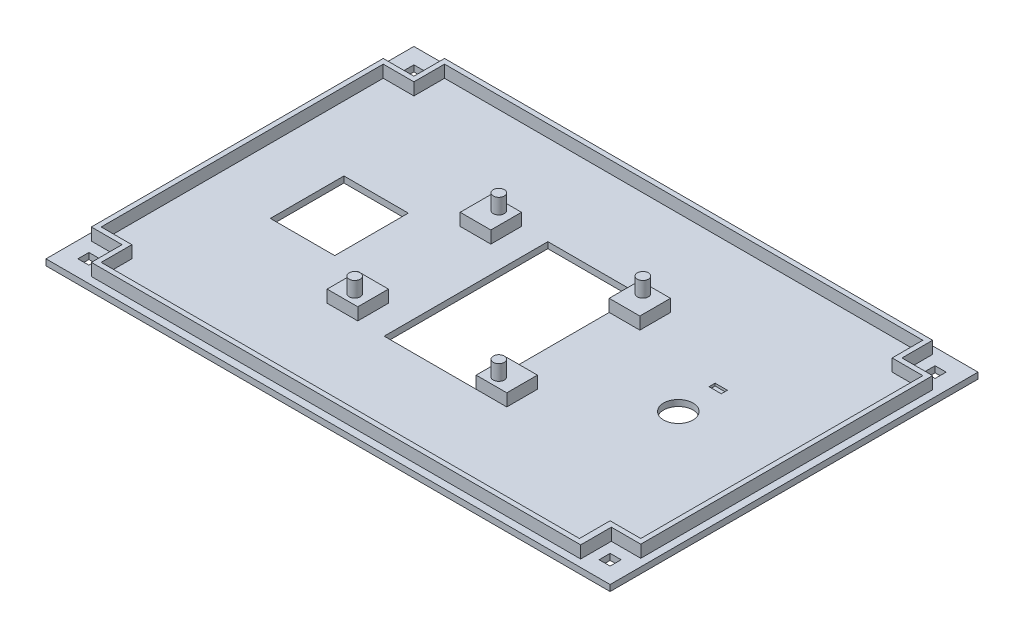
from build123d import *

# Parameters (mm, degrees)
SKETCH_1_W           = 92
SKETCH_1_H           = 60
EXTRUDE_1_DEPTH      = 1
EXTRUDE_3_DEPTH      = 2
SKETCH_6_W           = 1.8
SKETCH_6_H           = 1.8
CUT_EXTRUDE_3_DEPTH  = 1
SKETCH_7_W           = 1.8
SKETCH_7_H           = 1.8
CUT_EXTRUDE_4_DEPTH  = 1
SKETCH_8_W           = 1.8
SKETCH_8_H           = 1.8
CUT_EXTRUDE_5_DEPTH  = 1
SKETCH_9_W           = 1.8
SKETCH_9_H           = 1.8
CUT_EXTRUDE_6_DEPTH  = 1
SKETCH_15_W          = 15
SKETCH_15_H          = 26.7
CUT_EXTRUDE_8_DEPTH  = 1
SKETCH_18_W          = 5
SKETCH_18_H          = 5
EXTRUDE_4_DEPTH      = 2
SKETCH_19_R          = 0.9
EXTRUDE_5_DEPTH      = 2.5
SKETCH_10_W          = 10.5
SKETCH_10_H          = 12
CUT_EXTRUDE_9_DEPTH  = 1
SKETCH_20_R          = 2.4
CUT_EXTRUDE_11_DEPTH = 1
SKETCH_21_W          = 2
SKETCH_21_H          = 1
CUT_EXTRUDE_12_DEPTH = 0.4
CUT_EXTRUDE_13_DEPTH = 0.4


with BuildPart() as part:
    # Эскиз1 → Бобышка-Вытянуть1 (new body)
    with BuildSketch(Plane(origin=(0, 0, 0), x_dir=(1, 0, 0), z_dir=(0, 1, 0))):
        with Locations((46, 30)):
            Rectangle(SKETCH_1_W, SKETCH_1_H)
    extrude(amount=EXTRUDE_1_DEPTH)

    # Эскиз3 → Бобышка-Вытянуть3 (add)
    with BuildSketch(Plane(origin=(0, 1, 0), x_dir=(1, 0, 0), z_dir=(0, 1, 0))):
        Polygon((85.8, 53.8), (90.8, 53.8), (90.8, 6.2), (86, 6.2), (86, 1.2), (6.2, 1.2), (6.2, 6.2), (1.2, 6.2), (1.2, 53.8), (6.2, 53.8), (6.2, 58.8), (85.8, 58.8), align=None)
        Polygon((7, 58), (7, 53), (2, 53), (2, 7), (7, 7), (7, 2), (85, 2), (85, 7), (90, 7), (90, 53), (85, 53), (85, 58), align=None, mode=Mode.SUBTRACT)
    extrude(amount=EXTRUDE_3_DEPTH)

    # Эскиз6 → Вырез-Вытянуть3 (cut)
    with BuildSketch(Plane(origin=(0, 1, 0), x_dir=(1, 0, 0), z_dir=(0, 1, 0))):
        with Locations((3.5, 56.5)):
            Rectangle(SKETCH_6_W, SKETCH_6_H)
    extrude(amount=-CUT_EXTRUDE_3_DEPTH, mode=Mode.SUBTRACT)

    # Эскиз7 → Вырез-Вытянуть4 (cut)
    with BuildSketch(Plane(origin=(0, 1, 0), x_dir=(1, 0, 0), z_dir=(0, 1, 0))):
        with Locations((88.5, 56.5)):
            Rectangle(SKETCH_7_W, SKETCH_7_H)
    extrude(amount=-CUT_EXTRUDE_4_DEPTH, mode=Mode.SUBTRACT)

    # Эскиз8 → Вырез-Вытянуть5 (cut)
    with BuildSketch(Plane(origin=(0, 1, 0), x_dir=(1, 0, 0), z_dir=(0, 1, 0))):
        with Locations((88.5, 3.5)):
            Rectangle(SKETCH_8_W, SKETCH_8_H)
    extrude(amount=-CUT_EXTRUDE_5_DEPTH, mode=Mode.SUBTRACT)

    # Эскиз9 → Вырез-Вытянуть6 (cut)
    with BuildSketch(Plane(origin=(0, 1, 0), x_dir=(1, 0, 0), z_dir=(0, 1, 0))):
        with Locations((3.5, 3.5)):
            Rectangle(SKETCH_9_W, SKETCH_9_H)
    extrude(amount=-CUT_EXTRUDE_6_DEPTH, mode=Mode.SUBTRACT)

    # Эскиз15 → Вырез-Вытянуть8 (cut)
    with BuildSketch(Plane(origin=(0, 1, 0), x_dir=(1, 0, 0), z_dir=(0, 1, 0))):
        with Locations((46, 30)):
            Rectangle(SKETCH_15_W, SKETCH_15_H)
    extrude(amount=-CUT_EXTRUDE_8_DEPTH, mode=Mode.SUBTRACT)

    # Эскиз18 → Бобышка-Вытянуть4 (add)
    with BuildSketch(Plane(origin=(0, 1, 0), x_dir=(1, 0, 0), z_dir=(0, 1, 0))):
        with Locations((31.7, 40.85)):
            Rectangle(SKETCH_18_W, SKETCH_18_H)
        with Locations((31.7, 19.15)):
            Rectangle(SKETCH_18_W, SKETCH_18_H)
        with Locations((56, 40.85)):
            Rectangle(SKETCH_18_W, SKETCH_18_H)
        with Locations((56, 19.15)):
            Rectangle(SKETCH_18_W, SKETCH_18_H)
    extrude(amount=EXTRUDE_4_DEPTH)

    # Эскиз19 → Бобышка-Вытянуть5 (add)
    with BuildSketch(Plane(origin=(0, 3, 0), x_dir=(1, 0, 0), z_dir=(0, 1, 0))):
        with Locations((32.1, 41.75)):
            Circle(SKETCH_19_R)
        with Locations((32.1, 18.25)):
            Circle(SKETCH_19_R)
        with Locations((55.6, 41.75)):
            Circle(SKETCH_19_R)
        with Locations((55.6, 18.25)):
            Circle(SKETCH_19_R)
    extrude(amount=EXTRUDE_5_DEPTH)

    # Эскиз10 → Вырез-Вытянуть9 (cut)
    with BuildSketch(Plane(origin=(0, 1, 0), x_dir=(1, 0, 0), z_dir=(0, 1, 0))):
        with Locations((17.837788163, 30)):
            Rectangle(SKETCH_10_W, SKETCH_10_H)
    extrude(amount=-CUT_EXTRUDE_9_DEPTH, mode=Mode.SUBTRACT)

    # Эскиз20 → Вырез-Вытянуть11 (cut)
    with BuildSketch(Plane(origin=(0, 1, 0), x_dir=(1, 0, 0), z_dir=(0, 1, 0))):
        with Locations((73.124146683, 30)):
            Circle(SKETCH_20_R)
    extrude(amount=-CUT_EXTRUDE_11_DEPTH, mode=Mode.SUBTRACT)

    # Эскиз21 → Вырез-Вытянуть12 (cut)
    with BuildSketch(Plane(origin=(0, 1, 0), x_dir=(1, 0, 0), z_dir=(0, 1, 0))):
        with Locations((73.124146683, 36.5)):
            Rectangle(SKETCH_21_W, SKETCH_21_H)
    extrude(amount=-CUT_EXTRUDE_12_DEPTH, mode=Mode.SUBTRACT)

    # Эскиз22 → Вырез-Вытянуть13 (cut)
    # profile 1 of 19: a face of its own
    with BuildSketch(Plane(origin=(0, 0, 0), x_dir=(-1, 0, 0), z_dir=(0, -1, 0))):
        with BuildLine():
            Line((-6.570655821, 25.424472737), (-6.469404796, 25.859111284))
            add(Edge.make_bspline(
                [(-6.469404796, 25.859111284), (-6.42866707, 25.848222688), (-6.348979021, 25.826923244), (-6.234941019, 25.784806046), (-6.127904498, 25.737555442), (-6.028228713, 25.683932135), (-5.936347059, 25.62376797), (-5.851798196, 25.557325766), (-5.774447685, 25.484615344), (-5.705249825, 25.405078748), (-5.64335716, 25.320786828), (-5.590308991, 25.231149588), (-5.544050852, 25.13775734), (-5.506972443, 25.039082562), (-5.478848705, 24.935849752), (-5.458415772, 24.828316195), (-5.44581431, 24.716220632), (-5.444156624, 24.639810452), (-5.44331209, 24.600882082)],
                knots=[0, 0, 0, 0, 1.145367768, 2.240481511, 3.299486216, 4.322926322, 5.312543435, 6.280301985, 7.2416403, 8.192823262, 9.141388579, 10.079393599, 11.019812878, 11.970222822, 12.938950422, 13.923894909, 14.942295558, 16, 16, 16, 16], degree=3))
            add(Edge.make_bspline(
                [(-5.44331209, 24.600882082), (-5.443899781, 24.560942698), (-5.445049549, 24.482804485), (-5.454179645, 24.368307837), (-5.470558105, 24.259560116), (-5.491508604, 24.156173744), (-5.520271057, 24.058881927), (-5.554583179, 23.966980521), (-5.596126954, 23.881262605), (-5.64325851, 23.800821066), (-5.696831647, 23.726033128), (-5.755366986, 23.655188809), (-5.820484911, 23.590010412), (-5.890645542, 23.52886757), (-5.966775043, 23.473092173), (-6.047838988, 23.420632185), (-6.135265768, 23.37404816), (-6.227434476, 23.331613726), (-6.323452756, 23.294368116), (-6.421423981, 23.261418779), (-6.52154337, 23.234480895), (-6.622968435, 23.211289115), (-6.726552598, 23.194441411), (-6.831518662, 23.181064855), (-6.938510159, 23.173710156), (-7.010429062, 23.172742355), (-7.046659116, 23.172254813)],
                knots=[0, 0, 0, 0, 1.180680974, 2.309907975, 3.39230657, 4.430402719, 5.425739985, 6.38846843, 7.327253855, 8.238163682, 9.141319901, 10.044148192, 10.951882972, 11.861898394, 12.79276478, 13.739539846, 14.714057202, 15.718574761, 16.737652364, 17.7573291, 18.772768038, 19.801551793, 20.831755737, 21.873891013, 22.928945814, 24, 24, 24, 24], degree=3))
            add(Edge.make_bspline(
                [(-7.046659116, 23.172254813), (-7.085770876, 23.172952237), (-7.163045836, 23.17433017), (-7.277068033, 23.182105104), (-7.387110534, 23.196395531), (-7.493258994, 23.21620551), (-7.595742304, 23.241444119), (-7.694584556, 23.272170252), (-7.789383645, 23.308824995), (-7.880165198, 23.350454956), (-7.965820446, 23.3983352), (-8.047112416, 23.449875639), (-8.12245872, 23.50713182), (-8.193247002, 23.568128034), (-8.258272467, 23.634435586), (-8.317689317, 23.705839429), (-8.372037669, 23.781726863), (-8.420813468, 23.862085913), (-8.463611654, 23.945866435), (-8.501732378, 24.031823953), (-8.532977491, 24.120300374), (-8.558956548, 24.210594228), (-8.57963829, 24.30289991), (-8.593468235, 24.397433102), (-8.602480899, 24.494106454), (-8.603702331, 24.559291178), (-8.604319703, 24.592238701)],
                knots=[0, 0, 0, 0, 1.185610122, 2.34246615, 3.46204209, 4.547238403, 5.613845268, 6.659506797, 7.682407252, 8.692734231, 9.683951048, 10.654680354, 11.607833779, 12.549673105, 13.484816388, 14.419272854, 15.362680812, 16.31159957, 17.265732262, 18.21261905, 19.159670199, 20.10733745, 21.059306249, 22.024427552, 23.00144979, 24, 24, 24, 24], degree=3))
            add(Edge.make_bspline(
                [(-8.604319703, 24.592238701), (-8.603652237, 24.629108303), (-8.602340266, 24.701579156), (-8.590721426, 24.807782632), (-8.573311226, 24.909922408), (-8.547027641, 25.007202849), (-8.514784453, 25.100540365), (-8.473198343, 25.188464658), (-8.426078288, 25.272764465), (-8.37074248, 25.351878016), (-8.30900408, 25.426041853), (-8.241014787, 25.494587517), (-8.167224578, 25.557389804), (-8.087056239, 25.61367133), (-8.001050806, 25.664204492), (-7.909376708, 25.709532327), (-7.811449519, 25.748574864), (-7.743231079, 25.769454459), (-7.708495084, 25.780086093)],
                knots=[0, 0, 0, 0, 1.098215313, 2.158650937, 3.179873416, 4.182349117, 5.157851008, 6.118027029, 7.076341197, 8.032298369, 8.990121974, 9.948357669, 10.905435138, 11.873450097, 12.863034414, 13.874936208, 14.917943528, 16, 16, 16, 16], degree=3))
            Line((-7.708495084, 25.780086093), (-7.615270055, 25.345447547))
            add(Edge.make_bspline(
                [(-7.615270055, 25.345447547), (-7.641927536, 25.336911924), (-7.694104473, 25.320205069), (-7.768465881, 25.290540415), (-7.837497564, 25.258503577), (-7.900730274, 25.223331412), (-7.958179157, 25.184947695), (-8.010542419, 25.1442363), (-8.056842693, 25.100221824), (-8.098147547, 25.053799556), (-8.13333533, 25.00377074), (-8.164517496, 24.951308266), (-8.190315984, 24.895305965), (-8.212136175, 24.83656947), (-8.228743691, 24.774549778), (-8.240427734, 24.709499442), (-8.247189886, 24.641361307), (-8.248194152, 24.594928994), (-8.248706346, 24.571247635)],
                knots=[0, 0, 0, 0, 1.235697765, 2.418642872, 3.532555292, 4.594392283, 5.610119701, 6.580908344, 7.519430642, 8.427315627, 9.319973334, 10.216139639, 11.118687699, 12.038725643, 12.980015607, 13.949697744, 14.954307006, 16, 16, 16, 16], degree=3))
            add(Edge.make_bspline(
                [(-8.248706346, 24.571247635), (-8.248311504, 24.54405943), (-8.247534966, 24.490588254), (-8.239048929, 24.412029901), (-8.226523283, 24.336597086), (-8.207835559, 24.264803466), (-8.184238667, 24.196509333), (-8.156046818, 24.131405139), (-8.121735943, 24.069921589), (-8.082406539, 24.012121135), (-8.038255026, 23.958332122), (-7.990821012, 23.908365172), (-7.939993445, 23.862346005), (-7.885470108, 23.820826752), (-7.827051837, 23.783799683), (-7.765294928, 23.750291573), (-7.699786217, 23.721359095), (-7.607900086, 23.688657143), (-7.489324729, 23.656503936), (-7.344311841, 23.6279352), (-7.197137773, 23.609921214), (-7.098158192, 23.607904779), (-7.048511269, 23.60689336)],
                knots=[0, 0, 0, 0, 0.935100075, 1.839065892, 2.715632844, 3.564034634, 4.388093667, 5.199800233, 6.00171917, 6.806945003, 7.602082793, 8.393428172, 9.17553264, 9.958694158, 10.748327009, 11.553054559, 12.374096334, 13.209545573, 14.906836637, 16.595465087, 18.292327764, 20, 20, 20, 20], degree=3))
            add(Edge.make_bspline(
                [(-7.048511269, 23.60689336), (-6.986089569, 23.608046769), (-6.864781408, 23.610288264), (-6.689243263, 23.631868524), (-6.525589101, 23.665301569), (-6.398054296, 23.705251574), (-6.303847959, 23.745439215), (-6.237872901, 23.777935197), (-6.176823035, 23.815029589), (-6.120351314, 23.855798002), (-6.068622551, 23.900766021), (-6.021361937, 23.949307034), (-5.978114719, 24.001431916), (-5.940905377, 24.05775829), (-5.907866726, 24.116118084), (-5.878488127, 24.175774845), (-5.853641008, 24.236766133), (-5.834339262, 24.299338023), (-5.817659869, 24.362611838), (-5.806764107, 24.427284473), (-5.800614882, 24.493337486), (-5.799493107, 24.537690452), (-5.798925447, 24.560134718)],
                knots=[0, 0, 0, 0, 2.106854985, 4.094388766, 5.961441423, 7.741458329, 8.594569961, 9.418076185, 10.222480919, 11.003619353, 11.767127393, 12.533696482, 13.289066307, 14.050325982, 14.809648647, 15.552384038, 16.294338903, 17.030544626, 17.761979889, 18.502240791, 19.242077596, 20, 20, 20, 20], degree=3))
            add(Edge.make_bspline(
                [(-5.798925447, 24.560134718), (-5.799487167, 24.586918876), (-5.800596763, 24.639827059), (-5.810309118, 24.717397174), (-5.824621544, 24.792173695), (-5.846707062, 24.863250716), (-5.873748192, 24.931584302), (-5.907094634, 24.996614577), (-5.947200671, 25.058137031), (-5.992737308, 25.116875304), (-6.044550221, 25.171746209), (-6.102221977, 25.222032443), (-6.166015495, 25.267144877), (-6.234906982, 25.308975455), (-6.310954481, 25.344120829), (-6.391891351, 25.376673744), (-6.47904786, 25.403799184), (-6.53968118, 25.41748256), (-6.570655821, 25.424472737)],
                knots=[0, 0, 0, 0, 1.013374089, 2.001772144, 2.95501459, 3.891367103, 4.814208647, 5.733921849, 6.652182523, 7.590185968, 8.54346024, 9.504121027, 10.481158517, 11.497760682, 12.549996529, 13.647863555, 14.798406869, 16, 16, 16, 16], degree=3))
        make_face()
    # profile 2 of 19: a face of its own
    with BuildSketch(Plane(origin=(0, 0, 0), x_dir=(-1, 0, 0), z_dir=(0, -1, 0))):
        Polygon((-5.482824686, 27.163026924), (-8.209193751, 27.163026924), (-8.209193751, 26.175212045), (-8.564807107, 26.175212045), (-8.564807107, 28.585480349), (-8.209193751, 28.585480349), (-8.209193751, 27.59766547), (-5.482824686, 27.59766547), align=None)
    # profile 3 of 19: a face of its own
    with BuildSketch(Plane(origin=(0, 0, 0), x_dir=(-1, 0, 0), z_dir=(0, -1, 0))):
        Polygon((-5.482824686, 28.598445419), (-8.564807107, 29.8221011), (-8.564807107, 30.312304234), (-5.482824686, 31.535959915), (-5.482824686, 31.074773844), (-6.431126969, 30.724099562), (-6.431126969, 29.410305773), (-5.482824686, 29.059631491), align=None)
        with BuildLine():
            Line((-6.786740326, 29.541191244), (-6.786740326, 30.59321409))
            Line((-6.786740326, 30.59321409), (-7.596748526, 30.293782705))
            add(Edge.make_bspline(
                [(-7.596748526, 30.293782705), (-7.628046139, 30.282303575), (-7.689238882, 30.259859708), (-7.778146772, 30.22638914), (-7.862577353, 30.195810969), (-7.941320012, 30.165826561), (-8.015518565, 30.138759101), (-8.084671835, 30.113810329), (-8.148299173, 30.089136203), (-8.18940899, 30.074328914), (-8.209193751, 30.067202667)],
                knots=[0, 0, 0, 0, 1.225184869, 2.395467751, 3.491410812, 4.525364584, 5.492066482, 6.394148129, 7.227157926, 8, 8, 8, 8], degree=3))
            add(Edge.make_bspline(
                [(-8.209193751, 30.067202667), (-8.160416394, 30.05538553), (-8.062470839, 30.031656567), (-7.919065716, 29.982602177), (-7.777293459, 29.925566329), (-7.685972956, 29.879754666), (-7.639965427, 29.856674621)],
                knots=[0, 0, 0, 0, 0.989154277, 1.986234384, 2.985459177, 4, 4, 4, 4], degree=3))
            Line((-7.639965427, 29.856674621), (-6.786740326, 29.541191244))
        make_face(mode=Mode.SUBTRACT)
    # profile 4 of 19: a face of its own
    with BuildSketch(Plane(origin=(0, 0, 0), x_dir=(-1, 0, 0), z_dir=(0, -1, 0))):
        with BuildLine():
            Line((-5.482824686, 31.865025747), (-8.564807107, 31.865025747))
            Line((-8.564807107, 31.865025747), (-8.564807107, 32.997308551))
            add(Edge.make_bspline(
                [(-8.564807107, 32.997308551), (-8.564539731, 33.044240761), (-8.564037596, 33.132379671), (-8.558156955, 33.255464526), (-8.550881628, 33.36115949), (-8.540523454, 33.424999673), (-8.535790045, 33.454172933)],
                knots=[0, 0, 0, 0, 1.22865052, 2.30741144, 3.226532197, 4, 4, 4, 4], degree=3))
            add(Edge.make_bspline(
                [(-8.535790045, 33.454172933), (-8.529028905, 33.489788154), (-8.515911953, 33.558883475), (-8.482717393, 33.656093917), (-8.444028926, 33.745521834), (-8.39417145, 33.825471011), (-8.335962557, 33.89815412), (-8.26610319, 33.962267606), (-8.186275746, 34.0191097), (-8.096508556, 34.067440001), (-7.99992137, 34.107668366), (-7.897021967, 34.135844275), (-7.789598843, 34.153891045), (-7.716183373, 34.155790584), (-7.678860638, 34.156756265)],
                knots=[0, 0, 0, 0, 1.070963964, 2.077723998, 3.031409109, 3.947034396, 4.855896512, 5.777672756, 6.742175787, 7.747333477, 8.787332885, 9.830036646, 10.896840568, 12, 12, 12, 12], degree=3))
            add(Edge.make_bspline(
                [(-7.678860638, 34.156756265), (-7.646927322, 34.156075709), (-7.584096773, 34.154736676), (-7.491789627, 34.143238617), (-7.402986408, 34.125103689), (-7.318294771, 34.098052996), (-7.236724727, 34.064982757), (-7.159651468, 34.023306763), (-7.086030303, 33.974640418), (-7.016054347, 33.91880708), (-6.951171344, 33.853067705), (-6.896045733, 33.774007135), (-6.850069737, 33.682929919), (-6.81152558, 33.580562998), (-6.783413803, 33.465819886), (-6.76150012, 33.339647281), (-6.749726443, 33.201061712), (-6.748081964, 33.10475323), (-6.74722773, 33.054725291)],
                knots=[0, 0, 0, 0, 0.928734587, 1.827336177, 2.702165944, 3.561887964, 4.410255795, 5.259404997, 6.106313752, 6.974995773, 7.859929622, 8.783555066, 9.766301868, 10.821656499, 11.958701757, 13.197967894, 14.544469954, 16, 16, 16, 16], degree=3))
            Line((-6.74722773, 33.054725291), (-6.74722773, 32.299664293))
            Line((-6.74722773, 32.299664293), (-5.482824686, 32.299664293))
            Line((-5.482824686, 32.299664293), (-5.482824686, 31.865025747))
        make_face()
        with BuildLine():
            Line((-7.102841087, 32.299664293), (-7.102841087, 33.04299499))
            add(Edge.make_bspline(
                [(-7.102841087, 33.04299499), (-7.103338695, 33.072641308), (-7.104297291, 33.129752193), (-7.110936016, 33.212284985), (-7.12255733, 33.287993406), (-7.138374832, 33.357311063), (-7.159355737, 33.419723831), (-7.184438848, 33.475930209), (-7.214833999, 33.52508947), (-7.249894819, 33.567710097), (-7.289194646, 33.604281705), (-7.332050181, 33.636001626), (-7.37867225, 33.662744499), (-7.429151605, 33.68417138), (-7.482930117, 33.701879791), (-7.541029035, 33.713074677), (-7.602507074, 33.720826432), (-7.644878515, 33.721681255), (-7.666512952, 33.722117719)],
                knots=[0, 0, 0, 0, 1.40421292, 2.705086056, 3.918275699, 5.029558377, 6.068365212, 7.032404237, 7.938575147, 8.797260087, 9.638618655, 10.474993364, 11.317706051, 12.177828306, 13.068718597, 13.993981992, 14.975747128, 16, 16, 16, 16], degree=3))
            add(Edge.make_bspline(
                [(-7.666512952, 33.722117719), (-7.697885669, 33.721195832), (-7.758675041, 33.719409536), (-7.846166858, 33.701452155), (-7.926944323, 33.673214031), (-7.999645608, 33.633161105), (-8.062709721, 33.583626294), (-8.115710352, 33.527139091), (-8.156346429, 33.462215341), (-8.173407839, 33.414627917), (-8.182028842, 33.39058235)],
                knots=[0, 0, 0, 0, 1.143451971, 2.215610693, 3.244091205, 4.255765529, 5.229231363, 6.159234871, 7.069875225, 8, 8, 8, 8], degree=3))
            add(Edge.make_bspline(
                [(-8.182028842, 33.39058235), (-8.184187476, 33.381754378), (-8.188878337, 33.362570588), (-8.194202534, 33.33079279), (-8.199244076, 33.293963997), (-8.202588905, 33.251904686), (-8.205910745, 33.204998428), (-8.20744203, 33.153101824), (-8.208764625, 33.096096656), (-8.209046339, 33.056372705), (-8.209193751, 33.035586378)],
                knots=[0, 0, 0, 0, 0.611063981, 1.327884044, 2.165719042, 3.110592661, 4.16481496, 5.328235826, 6.601947678, 8, 8, 8, 8], degree=3))
            Line((-8.209193751, 33.035586378), (-8.209193751, 32.299664293))
            Line((-8.209193751, 32.299664293), (-7.102841087, 32.299664293))
        make_face(mode=Mode.SUBTRACT)
    # profile 5 of 19: a face of its own
    with BuildSketch(Plane(origin=(0, 0, 0), x_dir=(-1, 0, 0), z_dir=(0, -1, 0))):
        Polygon((-5.482824686, 35.460671905), (-8.209193751, 35.460671905), (-8.209193751, 34.472857027), (-8.564807107, 34.472857027), (-8.564807107, 36.883125331), (-8.209193751, 36.883125331), (-8.209193751, 35.895310452), (-5.482824686, 35.895310452), align=None)
    # profile 6 of 19: a face of its own
    with BuildSketch(Plane(origin=(0, 0, 0), x_dir=(-1, 0, 0), z_dir=(0, -1, 0))):
        with BuildLine():
            Line((-64.174693356, 41.054203842), (-64.490794117, 41.054203842))
            add(Edge.make_bspline(
                [(-64.490794117, 41.054203842), (-64.486314994, 41.084573701), (-64.477957245, 41.141241868), (-64.456640395, 41.218419293), (-64.426859406, 41.280549481), (-64.390167209, 41.329253258), (-64.345584748, 41.364660451), (-64.297145222, 41.393671519), (-64.242536648, 41.414428898), (-64.192436952, 41.426523544), (-64.146532776, 41.432316535), (-64.104217722, 41.437719455), (-64.054325287, 41.440910537), (-63.99691182, 41.444083618), (-63.93207281, 41.446405071), (-63.859634358, 41.448473056), (-63.779771814, 41.448639335), (-63.724002303, 41.449093496), (-63.694985755, 41.449329794)],
                knots=[0, 0, 0, 0, 1.447810451, 2.70151949, 3.761071597, 4.681645368, 5.550644144, 6.429888993, 7.336843752, 8.295347529, 8.854221167, 9.519029888, 10.307665071, 11.211965247, 12.232216441, 13.368617127, 14.630907028, 16, 16, 16, 16], degree=3))
            add(Edge.make_bspline(
                [(-63.694985755, 41.449329794), (-63.65629207, 41.449499573), (-63.58217048, 41.449824803), (-63.475710669, 41.454118012), (-63.37892755, 41.461419035), (-63.291616803, 41.471303461), (-63.213699173, 41.482912533), (-63.145693612, 41.499061098), (-63.087149765, 41.517316173), (-63.022233859, 41.544757685), (-62.953235849, 41.59025434), (-62.882123402, 41.656871497), (-62.824613218, 41.738370573), (-62.780408946, 41.83365436), (-62.746011398, 41.942256295), (-62.721692445, 42.065103297), (-62.70412593, 42.201875137), (-62.700045047, 42.297969224), (-62.697910112, 42.348241333)],
                knots=[0, 0, 0, 0, 1.168079359, 2.237571843, 3.215832227, 4.097464159, 4.89008186, 5.592324794, 6.205352649, 6.73969271, 7.715108044, 8.68195796, 9.666354411, 10.705682302, 11.841323562, 13.097561565, 14.481574619, 16, 16, 16, 16], degree=3))
            add(Edge.make_bspline(
                [(-62.697910112, 42.348241333), (-62.722657161, 42.311453134), (-62.770782121, 42.239912055), (-62.854025536, 42.144644926), (-62.944118629, 42.064587508), (-63.039836221, 41.997830299), (-63.142639054, 41.947178823), (-63.251270267, 41.91015278), (-63.36647997, 41.88820434), (-63.44546859, 41.885397623), (-63.485692478, 41.88396834)],
                knots=[0, 0, 0, 0, 1.110237516, 2.159050787, 3.15987179, 4.123962007, 5.074118526, 6.021584412, 6.992518568, 8, 8, 8, 8], degree=3))
            add(Edge.make_bspline(
                [(-63.485692478, 41.88396834), (-63.522576973, 41.884928096), (-63.594979339, 41.886812046), (-63.701275417, 41.901339716), (-63.802777475, 41.925054597), (-63.899169707, 41.959639359), (-63.991033742, 42.00251579), (-64.077272828, 42.056500148), (-64.159266649, 42.118966972), (-64.235415482, 42.190976744), (-64.30471568, 42.271292045), (-64.365377739, 42.358948992), (-64.416071646, 42.453825647), (-64.458685186, 42.554878466), (-64.490046839, 42.663412013), (-64.51400039, 42.778291976), (-64.527241316, 42.90007974), (-64.529270017, 42.983500232), (-64.530306712, 43.026129294)],
                knots=[0, 0, 0, 0, 1.017020763, 1.996359424, 2.953184604, 3.886712106, 4.815985037, 5.743748632, 6.687145925, 7.654818974, 8.628780691, 9.608086455, 10.58837866, 11.590850207, 12.627076538, 13.699062132, 14.824187913, 16, 16, 16, 16], degree=3))
            add(Edge.make_bspline(
                [(-64.530306712, 43.026129294), (-64.529817207, 43.058659015), (-64.528858795, 43.122349663), (-64.521829341, 43.215466101), (-64.511346036, 43.304276559), (-64.494051027, 43.388169861), (-64.474233829, 43.468227656), (-64.448758042, 43.543455004), (-64.419269599, 43.614456532), (-64.373313359, 43.70111143), (-64.309291727, 43.799845378), (-64.226347774, 43.907451875), (-64.134770148, 43.999021269), (-64.053178024, 44.06533064), (-63.98258761, 44.109740046), (-63.924954748, 44.137940764), (-63.862805003, 44.162112757), (-63.796140544, 44.181929293), (-63.72476789, 44.196227262), (-63.649210907, 44.207773419), (-63.568920962, 44.2135035), (-63.513893067, 44.214632742), (-63.485692478, 44.215211454)],
                knots=[0, 0, 0, 0, 1.093679396, 2.141338684, 3.138679113, 4.098139365, 5.019539308, 5.910153341, 6.766085864, 7.601779376, 9.204576951, 10.717610798, 12.161066056, 13.549758896, 14.242914697, 14.960875658, 15.70361923, 16.483073066, 17.295995467, 18.149350719, 19.051582818, 20, 20, 20, 20], degree=3))
            add(Edge.make_bspline(
                [(-63.485692478, 44.215211454), (-63.453165127, 44.214520436), (-63.389657134, 44.213171259), (-63.297152293, 44.205560338), (-63.210152154, 44.191059965), (-63.128547295, 44.171922674), (-63.052990763, 44.145502595), (-62.9825343, 44.114958042), (-62.918029104, 44.077714644), (-62.840014479, 44.020444273), (-62.752124558, 43.938685351), (-62.658328571, 43.828858975), (-62.579375828, 43.705124906), (-62.52304175, 43.591983974), (-62.486380532, 43.489577755), (-62.461775304, 43.399238574), (-62.442117583, 43.295517441), (-62.424707623, 43.179200668), (-62.412206514, 43.049566677), (-62.403107388, 42.906877984), (-62.397596022, 42.751024827), (-62.396957752, 42.642738204), (-62.396626574, 42.586551673)],
                knots=[0, 0, 0, 0, 0.870162468, 1.698947864, 2.479922643, 3.227576458, 3.937819425, 4.618010934, 5.278930023, 5.925246229, 7.203096592, 8.480223527, 9.778049416, 11.119750235, 11.851054765, 12.684343125, 13.621387403, 14.67311213, 15.829366811, 17.103607822, 18.497152973, 20, 20, 20, 20], degree=3))
            add(Edge.make_bspline(
                [(-62.396626574, 42.586551673), (-62.396857024, 42.550534798), (-62.397307517, 42.480127604), (-62.401026164, 42.376570274), (-62.407401514, 42.277589113), (-62.414811882, 42.182984885), (-62.426555567, 42.093134858), (-62.438754409, 42.007488699), (-62.455338488, 41.926518497), (-62.472774269, 41.84994996), (-62.49340155, 41.777900191), (-62.515941155, 41.710203048), (-62.541166342, 41.647045871), (-62.56927252, 41.58862223), (-62.59912508, 41.534307971), (-62.631964283, 41.484921985), (-62.666824771, 41.439725373), (-62.716989094, 41.385771936), (-62.786806753, 41.325395584), (-62.879997813, 41.262611533), (-62.983831856, 41.210211645), (-63.097965269, 41.167516493), (-63.222317, 41.134612132), (-63.356916053, 41.110591527), (-63.501855626, 41.09649805), (-63.601934871, 41.09466376), (-63.653621007, 41.093716437)],
                knots=[0, 0, 0, 0, 1.13881432, 2.226198728, 3.275858376, 4.27502977, 5.225799353, 6.140548384, 7.009603692, 7.838254902, 8.623026674, 9.378213121, 10.093548719, 10.771691928, 11.427101133, 12.051544054, 12.645081569, 13.229887208, 14.37825414, 15.554957591, 16.774302763, 18.046932979, 19.401235528, 20.835896622, 22.365892172, 24, 24, 24, 24], degree=3))
            add(Edge.make_bspline(
                [(-63.653621007, 41.093716437), (-63.68490202, 41.093778095), (-63.743966274, 41.093894516), (-63.827312196, 41.093128185), (-63.899957234, 41.0924751), (-63.961907623, 41.092106073), (-64.012946993, 41.090798821), (-64.053268473, 41.089451695), (-64.082965576, 41.088691409), (-64.107479176, 41.086241762), (-64.128920692, 41.08311534), (-64.148766647, 41.075935975), (-64.165021634, 41.067469809), (-64.171645922, 41.058383776), (-64.174693356, 41.054203842)],
                knots=[0, 0, 0, 0, 2.121546565, 4.005866589, 5.652915826, 7.048739931, 8.207552293, 9.115221962, 9.785765347, 10.220470559, 10.787256812, 11.246373005, 11.65330182, 12, 12, 12, 12], degree=3))
        make_face()
        with BuildLine():
            add(Edge.make_bspline(
                [(-64.13518076, 43.012546839), (-64.134766344, 42.984950057), (-64.133951131, 42.930663551), (-64.125776778, 42.851203888), (-64.112453567, 42.775575394), (-64.092895368, 42.704082375), (-64.069244401, 42.636085572), (-64.039369367, 42.572010116), (-64.003884071, 42.512116369), (-63.964268394, 42.455570836), (-63.918340148, 42.405392239), (-63.869074845, 42.360058278), (-63.814110711, 42.322964085), (-63.754914694, 42.292696704), (-63.69157369, 42.268012899), (-63.623350886, 42.252161696), (-63.551101204, 42.240820839), (-63.501381162, 42.2400025), (-63.475814329, 42.239581697)],
                knots=[0, 0, 0, 0, 1.155215058, 2.272460246, 3.340711256, 4.367059194, 5.372760775, 6.351976122, 7.321474712, 8.285134748, 9.23693223, 10.164389501, 11.08218885, 12.003299378, 12.944308493, 13.92033371, 14.930602667, 16, 16, 16, 16], degree=3))
            add(Edge.make_bspline(
                [(-63.475814329, 42.239581697), (-63.449230861, 42.240302863), (-63.397494811, 42.241706378), (-63.322143931, 42.252334182), (-63.25140421, 42.269988284), (-63.185481428, 42.295720069), (-63.123801686, 42.327682183), (-63.067385168, 42.367635297), (-63.01554802, 42.414457018), (-62.968830962, 42.468353094), (-62.927010586, 42.527931928), (-62.891116517, 42.592921841), (-62.860129523, 42.662236553), (-62.834641685, 42.736565792), (-62.816006537, 42.816081562), (-62.801502293, 42.899939222), (-62.793772374, 42.988736778), (-62.792437126, 43.049371056), (-62.791752525, 43.080459112)],
                knots=[0, 0, 0, 0, 1.041244924, 2.026443639, 2.974894649, 3.891272878, 4.792918297, 5.689937269, 6.591907093, 7.523343527, 8.478488283, 9.438622723, 10.427575594, 11.450045322, 12.511939121, 13.624070938, 14.781827365, 16, 16, 16, 16], degree=3))
            add(Edge.make_bspline(
                [(-62.791752525, 43.080459112), (-62.792300152, 43.111147772), (-62.793361329, 43.170615466), (-62.802837894, 43.257120368), (-62.81806694, 43.338109285), (-62.839385565, 43.413723474), (-62.86770402, 43.483357471), (-62.900495249, 43.548175689), (-62.941405319, 43.606594953), (-62.987438498, 43.659515631), (-63.038172534, 43.706149701), (-63.091467287, 43.747426209), (-63.148001845, 43.78210025), (-63.207433537, 43.810910649), (-63.270244589, 43.832085684), (-63.335362845, 43.848632645), (-63.403523063, 43.857817793), (-63.44985878, 43.858999255), (-63.473344792, 43.859598098)],
                knots=[0, 0, 0, 0, 1.262646941, 2.446724699, 3.576235582, 4.651178906, 5.673450157, 6.665921952, 7.633842012, 8.600278783, 9.547183505, 10.465319824, 11.370275434, 12.271856035, 13.177168262, 14.093310203, 15.03356323, 16, 16, 16, 16], degree=3))
            add(Edge.make_bspline(
                [(-63.473344792, 43.859598098), (-63.497250064, 43.858840863), (-63.544266034, 43.857351561), (-63.613385213, 43.846930329), (-63.678753291, 43.828258734), (-63.740827526, 43.802779631), (-63.798978777, 43.76958865), (-63.854610174, 43.73008836), (-63.905650569, 43.682028149), (-63.953194372, 43.627640905), (-63.99617443, 43.567562925), (-64.033434704, 43.502114561), (-64.06493619, 43.432004701), (-64.090911082, 43.357254576), (-64.110539426, 43.277638214), (-64.124602996, 43.193432232), (-64.133365718, 43.104515138), (-64.134567076, 43.043642277), (-64.13518076, 43.012546839)],
                knots=[0, 0, 0, 0, 0.951844141, 1.872050474, 2.774796237, 3.652881009, 4.537176522, 5.435485427, 6.36325005, 7.321457585, 8.308353997, 9.299358464, 10.31529039, 11.364870983, 12.446061216, 13.576351534, 14.761937466, 16, 16, 16, 16], degree=3))
        make_face(mode=Mode.SUBTRACT)
    # profile 7 of 19: a face of its own
    with BuildSketch(Plane(origin=(0, 0, 0), x_dir=(-1, 0, 0), z_dir=(0, -1, 0))):
        with BuildLine():
            Line((-66.50161478, 43.503984742), (-66.888714735, 43.543497337))
            add(Edge.make_bspline(
                [(-66.888714735, 43.543497337), (-66.880777913, 43.569608463), (-66.865164632, 43.620974156), (-66.833480435, 43.693822055), (-66.798681508, 43.763047164), (-66.757501367, 43.827065287), (-66.712645239, 43.88739565), (-66.662165955, 43.942563136), (-66.607013173, 43.99336429), (-66.547026146, 44.039818628), (-66.482163831, 44.081185234), (-66.412868321, 44.116966611), (-66.339295487, 44.147340111), (-66.261605032, 44.172817094), (-66.179102323, 44.191766409), (-66.092614851, 44.204948345), (-66.001940274, 44.214249692), (-65.940025705, 44.214885663), (-65.908308468, 44.215211454)],
                knots=[0, 0, 0, 0, 1.017323781, 2.001274869, 2.959303191, 3.905007698, 4.837087975, 5.761037643, 6.69017245, 7.631566209, 8.587870128, 9.556241258, 10.537222351, 11.554546132, 12.603058264, 13.691134057, 14.817227518, 16, 16, 16, 16], degree=3))
            add(Edge.make_bspline(
                [(-65.908308468, 44.215211454), (-65.868560711, 44.214165519), (-65.790885867, 44.212121557), (-65.677413769, 44.199029918), (-65.570779782, 44.174340066), (-65.469870824, 44.142135048), (-65.375880111, 44.098881331), (-65.287089102, 44.04797511), (-65.206302713, 43.985313791), (-65.131250695, 43.914976604), (-65.063671091, 43.835977992), (-65.00586406, 43.74829486), (-64.955754153, 43.65384645), (-64.915893417, 43.551148587), (-64.884389063, 43.441215745), (-64.862529557, 43.323583968), (-64.848543975, 43.198718852), (-64.847131957, 43.112808183), (-64.846407473, 43.068728811)],
                knots=[0, 0, 0, 0, 1.077514581, 2.105672966, 3.089476038, 4.040274705, 4.971431025, 5.888919861, 6.808238254, 7.735577247, 8.673393093, 9.618677744, 10.576827782, 11.566071718, 12.598940494, 13.672172662, 14.805629521, 16, 16, 16, 16], degree=3))
            add(Edge.make_bspline(
                [(-64.846407473, 43.068728811), (-64.84713178, 43.023005756), (-64.848538162, 42.934225521), (-64.862464726, 42.80478895), (-64.884972155, 42.683342976), (-64.916485569, 42.569403782), (-64.956868209, 42.463430439), (-65.007729752, 42.365777157), (-65.065909257, 42.275045506), (-65.134352806, 42.193585606), (-65.209404951, 42.120915355), (-65.290325372, 42.057432719), (-65.376287499, 42.003127274), (-65.468437587, 41.960084336), (-65.565405096, 41.925888244), (-65.667709286, 41.90098806), (-65.775791301, 41.88686742), (-65.849616423, 41.884948363), (-65.887317402, 41.88396834)],
                knots=[0, 0, 0, 0, 1.232146047, 2.392452017, 3.504407964, 4.558277538, 5.575096589, 6.555128708, 7.521420677, 8.47461407, 9.41617836, 10.332834734, 11.24251511, 12.150739645, 13.068352328, 14.010194393, 14.983847001, 16, 16, 16, 16], degree=3))
            add(Edge.make_bspline(
                [(-65.887317402, 41.88396834), (-65.923796136, 41.884900028), (-65.995186082, 41.886723368), (-66.099733672, 41.901545526), (-66.19957974, 41.924260608), (-66.293623447, 41.958876323), (-66.383021017, 42.001642435), (-66.467055546, 42.054290458), (-66.546103679, 42.116608996), (-66.61935295, 42.188195278), (-66.686114875, 42.268106492), (-66.743829942, 42.356704887), (-66.792910235, 42.45284884), (-66.832122282, 42.557162588), (-66.86301465, 42.668758303), (-66.88496509, 42.787946734), (-66.898937738, 42.914872765), (-66.900341035, 43.002218815), (-66.901062421, 43.04712036)],
                knots=[0, 0, 0, 0, 1.005369277, 1.967536996, 2.906194001, 3.82340783, 4.724347318, 5.634371901, 6.551585731, 7.494554804, 8.453555035, 9.416726127, 10.403884227, 11.423989226, 12.484028395, 13.59247144, 14.762373872, 16, 16, 16, 16], degree=3))
            add(Edge.make_bspline(
                [(-66.901062421, 43.04712036), (-66.900876213, 43.061320547), (-66.900433602, 43.095073995), (-66.899658995, 43.128821542), (-66.899210268, 43.148371385)],
                knots=[0, 0, 0, 0, 0.841406606, 2, 2, 2, 2], degree=3))
            Line((-66.899210268, 43.148371385), (-65.241533425, 43.148371385))
            add(Edge.make_bspline(
                [(-65.241533425, 43.148371385), (-65.243820902, 43.176198438), (-65.248296123, 43.230639276), (-65.26134652, 43.30945957), (-65.278958348, 43.383534479), (-65.302665935, 43.452211794), (-65.330672522, 43.516260591), (-65.365283836, 43.574627676), (-65.403844179, 43.628608261), (-65.448147601, 43.676890358), (-65.495964815, 43.719825372), (-65.547116041, 43.757530698), (-65.601435277, 43.788559403), (-65.658133818, 43.8153113), (-65.718211585, 43.834640882), (-65.780997464, 43.848957624), (-65.846734105, 43.857772221), (-65.89161196, 43.858981721), (-65.914482311, 43.859598098)],
                knots=[0, 0, 0, 0, 1.224701267, 2.396005229, 3.502034591, 4.561483905, 5.58012448, 6.563575487, 7.533543345, 8.485993125, 9.432387909, 10.349909037, 11.268362855, 12.173401338, 13.095753308, 14.031141616, 14.99664363, 16, 16, 16, 16], degree=3))
            add(Edge.make_bspline(
                [(-65.914482311, 43.859598098), (-65.947874078, 43.858482432), (-66.01235938, 43.856327887), (-66.105787072, 43.841128191), (-66.191190503, 43.813672654), (-66.269903656, 43.776577736), (-66.340715645, 43.727181438), (-66.403176205, 43.66473314), (-66.458071677, 43.589895763), (-66.48677467, 43.533264441), (-66.50161478, 43.503984742)],
                knots=[0, 0, 0, 0, 1.096716534, 2.117950163, 3.097018359, 4.034242303, 4.966210859, 5.917371264, 6.923232884, 8, 8, 8, 8], degree=3))
        make_face()
        with BuildLine():
            Line((-65.241533425, 42.792758029), (-66.50593647, 42.792758029))
            add(Edge.make_bspline(
                [(-66.50593647, 42.792758029), (-66.503452156, 42.773179799), (-66.498594778, 42.734900078), (-66.488318591, 42.679551507), (-66.474856323, 42.628104709), (-66.45795865, 42.58067904), (-66.438394074, 42.536751898), (-66.415533945, 42.49673424), (-66.39025168, 42.460208238), (-66.370576532, 42.438989605), (-66.360851159, 42.428501292)],
                knots=[0, 0, 0, 0, 1.185375606, 2.317668634, 3.379182944, 4.376256932, 5.339019372, 6.263642956, 7.141723434, 8, 8, 8, 8], degree=3))
            add(Edge.make_bspline(
                [(-66.360851159, 42.428501292), (-66.3453414, 42.413300826), (-66.314589359, 42.383162037), (-66.262890422, 42.345014918), (-66.208190808, 42.312707997), (-66.150304822, 42.285949846), (-66.088928844, 42.264796867), (-66.023918077, 42.25014977), (-65.955672694, 42.241432154), (-65.909157346, 42.240206149), (-65.885465249, 42.239581697)],
                knots=[0, 0, 0, 0, 0.989757336, 1.962445513, 2.922132607, 3.884113302, 4.866899171, 5.878154413, 6.919260533, 8, 8, 8, 8], degree=3))
            add(Edge.make_bspline(
                [(-65.885465249, 42.239581697), (-65.86384051, 42.240098365), (-65.821306997, 42.241114596), (-65.758911946, 42.247853829), (-65.699185217, 42.259560015), (-65.642271228, 42.276422886), (-65.587600514, 42.29734122), (-65.535577822, 42.323213252), (-65.486726496, 42.354526055), (-65.440279431, 42.389402499), (-65.398244815, 42.428819701), (-65.359774508, 42.47075333), (-65.32793197, 42.517114211), (-65.299696796, 42.56572532), (-65.277588944, 42.618108287), (-65.260184536, 42.673490229), (-65.247795348, 42.732024109), (-65.243639331, 42.772333003), (-65.241533425, 42.792758029)],
                knots=[0, 0, 0, 0, 1.102665462, 2.168823275, 3.195785124, 4.201947785, 5.191946361, 6.177485462, 7.158600939, 8.147152392, 9.134756502, 10.093390301, 11.042499578, 11.996585016, 12.955620794, 13.934713813, 14.953493427, 16, 16, 16, 16], degree=3))
        make_face(mode=Mode.SUBTRACT)
    # profile 8 of 19: a face of its own
    with BuildSketch(Plane(origin=(0, 0, 0), x_dir=(-1, 0, 0), z_dir=(0, -1, 0))):
        with BuildLine():
            Line((-67.8888773, 43.148371385), (-67.8888773, 42.792758029))
            add(Edge.make_bspline(
                [(-67.8888773, 42.792758029), (-67.924479526, 42.792229721), (-67.989729377, 42.791261466), (-68.078292229, 42.788729056), (-68.148477337, 42.783627193), (-68.203421579, 42.778310037), (-68.248763388, 42.767421337), (-68.289657441, 42.749230527), (-68.329928506, 42.725345448), (-68.367494463, 42.69425336), (-68.400546186, 42.657894418), (-68.424602574, 42.615384613), (-68.439220132, 42.568351593), (-68.441097595, 42.535412541), (-68.442053632, 42.5186394)],
                knots=[0, 0, 0, 0, 1.839295496, 3.370962123, 4.575177622, 5.474416927, 6.219515099, 6.97185766, 7.777649614, 8.631047526, 9.482058678, 10.300857652, 11.134767037, 12, 12, 12, 12], degree=3))
            add(Edge.make_bspline(
                [(-68.442053632, 42.5186394), (-68.440984317, 42.49830934), (-68.438916045, 42.458986903), (-68.419408845, 42.403414151), (-68.387608589, 42.354569335), (-68.34371025, 42.313361931), (-68.290312735, 42.279772557), (-68.22843939, 42.256866826), (-68.159772519, 42.242123675), (-68.111630323, 42.240454881), (-68.086440276, 42.239581697)],
                knots=[0, 0, 0, 0, 0.960482297, 1.857766531, 2.752929272, 3.697693933, 4.687808438, 5.721744542, 6.807919688, 8, 8, 8, 8], degree=3))
            add(Edge.make_bspline(
                [(-68.086440276, 42.239581697), (-68.061458542, 42.240453633), (-68.013081198, 42.242142145), (-67.943462014, 42.257395746), (-67.879591205, 42.28221484), (-67.821413388, 42.317148602), (-67.769505038, 42.362538943), (-67.723656451, 42.417703939), (-67.682995674, 42.48236759), (-67.662451479, 42.530652439), (-67.651801729, 42.555682458)],
                knots=[0, 0, 0, 0, 1.040390029, 2.014724385, 2.954721802, 3.886105131, 4.828800269, 5.815260075, 6.8674691, 8, 8, 8, 8], degree=3))
            Line((-67.651801729, 42.555682458), (-67.217163182, 42.516169863))
            add(Edge.make_bspline(
                [(-67.217163182, 42.516169863), (-67.224652765, 42.490546544), (-67.239306951, 42.440411725), (-67.266442808, 42.368449411), (-67.298200485, 42.30189155), (-67.33251261, 42.239511497), (-67.371681134, 42.182707806), (-67.414284981, 42.130301131), (-67.461438101, 42.083624919), (-67.511660607, 42.040958959), (-67.566153466, 42.004224382), (-67.624006452, 41.971605785), (-67.685937448, 41.944620038), (-67.75179478, 41.922233206), (-67.821449652, 41.905187909), (-67.894896216, 41.892807588), (-67.972067946, 41.885320555), (-68.024890736, 41.884425457), (-68.051866755, 41.88396834)],
                knots=[0, 0, 0, 0, 1.122723975, 2.196732005, 3.230673319, 4.222855838, 5.188123969, 6.129175962, 7.05961643, 7.975157846, 8.897183724, 9.819575283, 10.765353715, 11.734457287, 12.742265098, 13.778342395, 14.865423827, 16, 16, 16, 16], degree=3))
            add(Edge.make_bspline(
                [(-68.051866755, 41.88396834), (-68.081726257, 41.88459009), (-68.139927918, 41.885801995), (-68.224812631, 41.894371297), (-68.304484585, 41.909167324), (-68.379400477, 41.929450654), (-68.449174582, 41.956142825), (-68.514517004, 41.987935356), (-68.574095494, 42.02692045), (-68.628980081, 42.070246082), (-68.677217749, 42.118572475), (-68.720400542, 42.168487149), (-68.756477722, 42.221280708), (-68.785660075, 42.276676748), (-68.80851282, 42.334253236), (-68.825434893, 42.393964897), (-68.835560828, 42.455935646), (-68.836636753, 42.498022802), (-68.837179584, 42.519256784)],
                knots=[0, 0, 0, 0, 1.26861264, 2.472759363, 3.620071859, 4.708286775, 5.765461966, 6.789986675, 7.789237632, 8.784732425, 9.755457947, 10.685846931, 11.585614755, 12.465665484, 13.340837652, 14.212815352, 15.098322335, 16, 16, 16, 16], degree=3))
            add(Edge.make_bspline(
                [(-68.837179584, 42.519256784), (-68.836206865, 42.540532065), (-68.834286354, 42.58253743), (-68.819643582, 42.643940202), (-68.795304055, 42.701821682), (-68.761281701, 42.756348793), (-68.717589518, 42.807330326), (-68.663660685, 42.854104558), (-68.601010024, 42.898274307), (-68.554500017, 42.923503058), (-68.530339587, 42.936608571)],
                knots=[0, 0, 0, 0, 0.932066351, 1.840247736, 2.750085694, 3.673906612, 4.646612121, 5.682062844, 6.795907315, 8, 8, 8, 8], degree=3))
            add(Edge.make_bspline(
                [(-68.530339587, 42.936608571), (-68.557958733, 42.952586087), (-68.611591188, 42.983612153), (-68.682554494, 43.040466997), (-68.742777818, 43.103449801), (-68.792244977, 43.173184759), (-68.829947902, 43.250046613), (-68.857427423, 43.333062959), (-68.873572728, 43.422895518), (-68.875632031, 43.484985375), (-68.876692179, 43.516949812)],
                knots=[0, 0, 0, 0, 1.071664795, 2.081020633, 3.045249586, 3.99365648, 4.9437028, 5.913082532, 6.925635428, 8, 8, 8, 8], degree=3))
            add(Edge.make_bspline(
                [(-68.876692179, 43.516949812), (-68.876249575, 43.542308205), (-68.875381888, 43.592021176), (-68.86414257, 43.664491139), (-68.848059739, 43.733653438), (-68.823493496, 43.798635504), (-68.793094748, 43.860386895), (-68.756101414, 43.918579494), (-68.711742672, 43.972652721), (-68.660928913, 44.022562712), (-68.604581468, 44.06846738), (-68.541391577, 44.107357048), (-68.473280355, 44.140588618), (-68.400129515, 44.168788282), (-68.321185768, 44.189514597), (-68.23688821, 44.203999729), (-68.14736879, 44.21359062), (-68.085848574, 44.21466244), (-68.054336292, 44.215211454)],
                knots=[0, 0, 0, 0, 0.999062271, 1.958576534, 2.885692741, 3.794729737, 4.691217627, 5.596260752, 6.507613401, 7.443039959, 8.401249088, 9.367330758, 10.361833641, 11.386767042, 12.45376505, 13.574562247, 14.757626642, 16, 16, 16, 16], degree=3))
            add(Edge.make_bspline(
                [(-68.054336292, 44.215211454), (-68.023654473, 44.214587426), (-67.963811825, 44.213370305), (-67.876462952, 44.204818082), (-67.794150436, 44.189912574), (-67.716537324, 44.169811628), (-67.644222453, 44.143218821), (-67.576727604, 44.110904173), (-67.51432514, 44.072520234), (-67.456389257, 44.028503658), (-67.403812934, 43.97837569), (-67.356518072, 43.922060378), (-67.313997456, 43.86022604), (-67.27591755, 43.792636593), (-67.244356593, 43.718632146), (-67.216095873, 43.639456545), (-67.194246993, 43.553975124), (-67.183272967, 43.494793151), (-67.177650587, 43.464472146)],
                knots=[0, 0, 0, 0, 1.149644563, 2.242297768, 3.28447786, 4.2814273, 5.242664331, 6.167002941, 7.080892691, 7.98315883, 8.888582975, 9.79695778, 10.733852572, 11.697067205, 12.69850991, 13.744790175, 14.844576737, 16, 16, 16, 16], degree=3))
            Line((-67.177650587, 43.464472146), (-67.612289134, 43.424959551))
            add(Edge.make_bspline(
                [(-67.612289134, 43.424959551), (-67.620030867, 43.458042017), (-67.634926278, 43.521694038), (-67.674520876, 43.608531286), (-67.722889851, 43.685032308), (-67.784403476, 43.74699899), (-67.851883383, 43.79780682), (-67.926119502, 43.833055503), (-68.00478297, 43.856302753), (-68.059313385, 43.858486858), (-68.08705766, 43.859598098)],
                knots=[0, 0, 0, 0, 1.161929031, 2.23559913, 3.254990029, 4.247745135, 5.211401429, 6.135839433, 7.051542478, 8, 8, 8, 8], degree=3))
            add(Edge.make_bspline(
                [(-68.08705766, 43.859598098), (-68.114142633, 43.858548022), (-68.166778446, 43.856507348), (-68.242210888, 43.83668099), (-68.310825127, 43.804383727), (-68.370162035, 43.758989747), (-68.420581654, 43.705301502), (-68.455256612, 43.641589052), (-68.478385841, 43.571830559), (-68.480488181, 43.522493008), (-68.481566227, 43.497193514)],
                knots=[0, 0, 0, 0, 1.08365366, 2.105927555, 3.102045451, 4.103374469, 5.084317192, 6.029659502, 6.989641439, 8, 8, 8, 8], degree=3))
            add(Edge.make_bspline(
                [(-68.481566227, 43.497193514), (-68.480836821, 43.477348611), (-68.479405327, 43.438402046), (-68.465088644, 43.38213285), (-68.44294293, 43.329596318), (-68.411861603, 43.282623654), (-68.376418809, 43.241934174), (-68.338042888, 43.209649464), (-68.299943445, 43.183769503), (-68.256674756, 43.167281753), (-68.204871213, 43.158127696), (-68.139724217, 43.150861511), (-68.058289761, 43.146968157), (-67.998568511, 43.146677497), (-67.966050337, 43.146519232)],
                knots=[0, 0, 0, 0, 0.995299735, 1.953322946, 2.898311219, 3.847645587, 4.770770215, 5.599604567, 6.362544303, 7.073018282, 7.906483748, 8.999277799, 10.366109098, 12, 12, 12, 12], degree=3))
            add(Edge.make_bspline(
                [(-67.966050337, 43.146519232), (-67.962345437, 43.146488323), (-67.953079377, 43.146411018), (-67.936420729, 43.147315903), (-67.914396593, 43.147782595), (-67.897932198, 43.148162467), (-67.8888773, 43.148371385)],
                knots=[0, 0, 0, 0, 0.575798422, 1.440088237, 2.592129284, 4, 4, 4, 4], degree=3))
        make_face()
    # profile 9 of 19: a face of its own
    with BuildSketch(Plane(origin=(0, 0, 0), x_dir=(-1, 0, 0), z_dir=(0, -1, 0))):
        Polygon((-70.154060294, 44.175698859), (-71.377715975, 41.093716437), (-71.867919109, 41.093716437), (-73.09157479, 44.175698859), (-72.630388718, 44.175698859), (-72.279714436, 43.227396576), (-70.965920647, 43.227396576), (-70.615246365, 44.175698859), align=None)
        with BuildLine():
            Line((-71.096806119, 42.871783219), (-72.148828965, 42.871783219))
            Line((-72.148828965, 42.871783219), (-71.84939758, 42.061775019))
            add(Edge.make_bspline(
                [(-71.84939758, 42.061775019), (-71.837918449, 42.030477406), (-71.815474582, 41.969284663), (-71.782004015, 41.880376773), (-71.751425844, 41.795946192), (-71.721441436, 41.717203533), (-71.694373975, 41.643004979), (-71.669425203, 41.57385171), (-71.644751078, 41.510224371), (-71.629943788, 41.469114555), (-71.622817542, 41.449329794)],
                knots=[0, 0, 0, 0, 1.225184869, 2.395467751, 3.491410812, 4.525364584, 5.492066482, 6.394148129, 7.227157926, 8, 8, 8, 8], degree=3))
            add(Edge.make_bspline(
                [(-71.622817542, 41.449329794), (-71.611000404, 41.498107151), (-71.587271441, 41.596052706), (-71.538217051, 41.739457829), (-71.481181203, 41.881230086), (-71.435369541, 41.972550589), (-71.412289496, 42.018558118)],
                knots=[0, 0, 0, 0, 0.989154277, 1.986234384, 2.985459177, 4, 4, 4, 4], degree=3))
            Line((-71.412289496, 42.018558118), (-71.096806119, 42.871783219))
        make_face(mode=Mode.SUBTRACT)
    # profile 10 of 19: a face of its own
    with BuildSketch(Plane(origin=(0, 0, 0), x_dir=(-1, 0, 0), z_dir=(0, -1, 0))):
        Polygon((-73.420640621, 44.175698859), (-73.420640621, 41.093716437), (-73.855279168, 41.093716437), (-73.855279168, 43.820085503), (-75.317245189, 43.820085503), (-75.317245189, 44.175698859), align=None)
    # profile 11 of 19: a face of its own
    with BuildSketch(Plane(origin=(0, 0, 0), x_dir=(-1, 0, 0), z_dir=(0, -1, 0))):
        Polygon((-75.369722854, 44.175698859), (-76.593378535, 41.093716437), (-77.083581669, 41.093716437), (-78.30723735, 44.175698859), (-77.846051278, 44.175698859), (-77.495376996, 43.227396576), (-76.181583208, 43.227396576), (-75.830908926, 44.175698859), align=None)
        with BuildLine():
            Line((-76.312468679, 42.871783219), (-77.364491525, 42.871783219))
            Line((-77.364491525, 42.871783219), (-77.06506014, 42.061775019))
            add(Edge.make_bspline(
                [(-77.06506014, 42.061775019), (-77.05358101, 42.030477406), (-77.031137142, 41.969284663), (-76.997666575, 41.880376773), (-76.967088404, 41.795946192), (-76.937103996, 41.717203533), (-76.910036535, 41.643004979), (-76.885087763, 41.57385171), (-76.860413638, 41.510224371), (-76.845606349, 41.469114555), (-76.838480102, 41.449329794)],
                knots=[0, 0, 0, 0, 1.225184869, 2.395467751, 3.491410812, 4.525364584, 5.492066482, 6.394148129, 7.227157926, 8, 8, 8, 8], degree=3))
            add(Edge.make_bspline(
                [(-76.838480102, 41.449329794), (-76.826662964, 41.498107151), (-76.802934001, 41.596052706), (-76.753879611, 41.739457829), (-76.696843763, 41.881230086), (-76.651032101, 41.972550589), (-76.627952056, 42.018558118)],
                knots=[0, 0, 0, 0, 0.989154277, 1.986234384, 2.985459177, 4, 4, 4, 4], degree=3))
            Line((-76.627952056, 42.018558118), (-76.312468679, 42.871783219))
        make_face(mode=Mode.SUBTRACT)
    # profile 12 of 19: a face of its own
    with BuildSketch(Plane(origin=(0, 0, 0), x_dir=(-1, 0, 0), z_dir=(0, -1, 0))):
        with BuildLine():
            Line((-78.636303181, 44.175698859), (-78.636303181, 41.093716437))
            Line((-78.636303181, 41.093716437), (-79.973557574, 41.093716437))
            add(Edge.make_bspline(
                [(-79.973557574, 41.093716437), (-80.00504597, 41.093961992), (-80.065988075, 41.094437233), (-80.154364266, 41.097833197), (-80.236659672, 41.105047924), (-80.313392954, 41.113105891), (-80.384432809, 41.125003638), (-80.449813093, 41.138961841), (-80.509283059, 41.155458813), (-80.563295207, 41.174958919), (-80.613410775, 41.197013138), (-80.659850901, 41.224239518), (-80.704609633, 41.254022438), (-80.745902791, 41.289304342), (-80.785590203, 41.327210933), (-80.822010273, 41.369638879), (-80.856240853, 41.415526247), (-80.897860716, 41.481975697), (-80.941572905, 41.57104645), (-80.979222953, 41.684209935), (-81.003163412, 41.802705694), (-81.005747699, 41.883647965), (-81.00705889, 41.924715704)],
                knots=[0, 0, 0, 0, 1.242075696, 2.40389213, 3.487198984, 4.500157661, 5.446319301, 6.326791195, 7.136300648, 7.878370406, 8.590488565, 9.292260633, 9.999224673, 10.708050372, 11.431369221, 12.162165018, 12.910600795, 13.687589445, 15.252257874, 16.810406251, 18.381693487, 20, 20, 20, 20], degree=3))
            add(Edge.make_bspline(
                [(-81.00705889, 41.924715704), (-81.006455796, 41.951079472), (-81.005264642, 42.003149722), (-80.996140417, 42.079707011), (-80.979630515, 42.1528541), (-80.958460978, 42.223233109), (-80.929482019, 42.289841364), (-80.895926498, 42.354059881), (-80.854297337, 42.414048057), (-80.807816149, 42.471810756), (-80.75376694, 42.524741258), (-80.693645891, 42.573661776), (-80.62564552, 42.615643806), (-80.551996116, 42.654658721), (-80.470799616, 42.686700123), (-80.38328054, 42.714913615), (-80.28876154, 42.736667015), (-80.223249013, 42.74762444), (-80.189642078, 42.753245434)],
                knots=[0, 0, 0, 0, 0.982645791, 1.940792824, 2.867691729, 3.775150443, 4.675643875, 5.571354211, 6.471357401, 7.392684514, 8.331098131, 9.285922955, 10.275520706, 11.304845665, 12.388884831, 13.524255008, 14.729980297, 16, 16, 16, 16], degree=3))
            add(Edge.make_bspline(
                [(-80.189642078, 42.753245434), (-80.214533013, 42.765652413), (-80.261736445, 42.789181138), (-80.32597021, 42.828111142), (-80.382241845, 42.864760409), (-80.414206457, 42.892242192), (-80.429187186, 42.905121971)],
                knots=[0, 0, 0, 0, 1.172551213, 2.223638478, 3.167479604, 4, 4, 4, 4], degree=3))
            add(Edge.make_bspline(
                [(-80.429187186, 42.905121971), (-80.458350948, 42.933623095), (-80.518161022, 42.992074205), (-80.599779678, 43.092556873), (-80.680540366, 43.20305905), (-80.729027396, 43.28358402), (-80.753931328, 43.324943295)],
                knots=[0, 0, 0, 0, 0.918170575, 1.883016652, 2.912673989, 4, 4, 4, 4], degree=3))
            Line((-80.753931328, 43.324943295), (-81.259569069, 44.175698859))
            Line((-81.259569069, 44.175698859), (-80.761339939, 44.175698859))
            Line((-80.761339939, 44.175698859), (-80.377326905, 43.524975808))
            add(Edge.make_bspline(
                [(-80.377326905, 43.524975808), (-80.36351888, 43.502144974), (-80.336761194, 43.457902567), (-80.298124526, 43.39327936), (-80.260191567, 43.333817111), (-80.225180347, 43.277664755), (-80.190870508, 43.226303144), (-80.160114032, 43.177788477), (-80.129226508, 43.134869131), (-80.093760776, 43.083306421), (-80.050448275, 43.027557806), (-79.999905649, 42.970287764), (-79.953435068, 42.922847804), (-79.894712242, 42.877583776), (-79.821693488, 42.836140138), (-79.760128266, 42.816480385), (-79.73030816, 42.806957868)],
                knots=[0, 0, 0, 0, 1.130591283, 2.190900266, 3.190104209, 4.119071823, 4.994606968, 5.807262858, 6.55236009, 7.234593472, 8.459046683, 9.540234366, 10.471327768, 11.266723835, 12.676093724, 14, 14, 14, 14], degree=3))
            add(Edge.make_bspline(
                [(-79.73030816, 42.806957868), (-79.717780789, 42.804698757), (-79.689180425, 42.799541139), (-79.640617079, 42.796172691), (-79.581776628, 42.792597534), (-79.53913395, 42.792701702), (-79.516075808, 42.792758029)],
                knots=[0, 0, 0, 0, 0.709978628, 1.620902492, 2.713552433, 4, 4, 4, 4], degree=3))
            Line((-79.516075808, 42.792758029), (-79.070941728, 42.792758029))
            Line((-79.070941728, 42.792758029), (-79.070941728, 44.175698859))
            Line((-79.070941728, 44.175698859), (-78.636303181, 44.175698859))
        make_face()
        with BuildLine():
            Line((-79.070941728, 42.437144673), (-79.896384536, 42.437144673))
            add(Edge.make_bspline(
                [(-79.896384536, 42.437144673), (-79.937777236, 42.436502675), (-80.015157006, 42.435302521), (-80.123332866, 42.424897342), (-80.215866649, 42.408632557), (-80.293940337, 42.383929088), (-80.35955366, 42.350846269), (-80.41642088, 42.310389182), (-80.464236282, 42.260197265), (-80.50356032, 42.202644785), (-80.534300987, 42.139924521), (-80.555781006, 42.073542821), (-80.570201938, 42.004772588), (-80.571676455, 41.957716229), (-80.572420344, 41.933976469)],
                knots=[0, 0, 0, 0, 1.546056516, 2.890207646, 4.055830773, 5.050253158, 5.937355789, 6.790906573, 7.644595853, 8.512568064, 9.38593768, 10.244184789, 11.114197691, 12, 12, 12, 12], degree=3))
            add(Edge.make_bspline(
                [(-80.572420344, 41.933976469), (-80.571849266, 41.916675895), (-80.570730691, 41.882789154), (-80.564804345, 41.833069057), (-80.553528956, 41.785951225), (-80.537959178, 41.741096008), (-80.518245568, 41.698406019), (-80.494020661, 41.658049162), (-80.465409454, 41.620231561), (-80.432589046, 41.58476704), (-80.394918497, 41.552492895), (-80.351886193, 41.52464862), (-80.303835766, 41.500986628), (-80.250710166, 41.482206989), (-80.192677094, 41.467186306), (-80.129406079, 41.457193537), (-80.061186502, 41.449962801), (-80.01391429, 41.449544738), (-79.989609565, 41.449329794)],
                knots=[0, 0, 0, 0, 0.965235723, 1.89061323, 2.787065514, 3.661873922, 4.534873316, 5.404925039, 6.281839248, 7.175200054, 8.095223355, 9.040740021, 10.02630299, 11.075573487, 12.177989335, 13.364883635, 14.645170704, 16, 16, 16, 16], degree=3))
            Line((-79.989609565, 41.449329794), (-79.070941728, 41.449329794))
            Line((-79.070941728, 41.449329794), (-79.070941728, 42.437144673))
        make_face(mode=Mode.SUBTRACT)
    # profile 13 of 19: a face of its own
    with BuildSketch(Plane(origin=(0, 0, 0), x_dir=(-1, 0, 0), z_dir=(0, -1, 0))):
        with BuildLine():
            Line((-81.639260413, 44.175698859), (-81.639260413, 41.093716437))
            Line((-81.639260413, 41.093716437), (-82.293070386, 41.093716437))
            Line((-82.293070386, 41.093716437), (-82.982071264, 43.256413638))
            add(Edge.make_bspline(
                [(-82.982071264, 43.256413638), (-82.989653748, 43.280913228), (-83.00431783, 43.328294009), (-83.026062925, 43.396716217), (-83.045847316, 43.460299323), (-83.063666275, 43.519245714), (-83.080482257, 43.573262725), (-83.095042248, 43.622793606), (-83.108962073, 43.667287957), (-83.117119712, 43.695565572), (-83.120982731, 43.708956329)],
                knots=[0, 0, 0, 0, 1.300204174, 2.514519184, 3.639827924, 4.676153899, 5.636536826, 6.507959918, 7.293450077, 8, 8, 8, 8], degree=3))
            add(Edge.make_bspline(
                [(-83.120982731, 43.708956329), (-83.125285237, 43.694339146), (-83.134441246, 43.663232847), (-83.1492846, 43.614323524), (-83.165078351, 43.560199854), (-83.183978629, 43.501792135), (-83.203679933, 43.438184134), (-83.224359015, 43.369428674), (-83.248211934, 43.296212197), (-83.264063391, 43.245523305), (-83.272241884, 43.21937058)],
                knots=[0, 0, 0, 0, 0.713638162, 1.518667645, 2.393860736, 3.354087503, 4.393659122, 5.512594909, 6.716633584, 8, 8, 8, 8], degree=3))
            Line((-83.272241884, 43.21937058), (-83.954451535, 41.093716437))
            Line((-83.954451535, 41.093716437), (-84.602705049, 41.093716437))
            Line((-84.602705049, 41.093716437), (-84.602705049, 44.175698859))
            Line((-84.602705049, 44.175698859), (-84.168066503, 44.175698859))
            Line((-84.168066503, 44.175698859), (-84.168066503, 41.567867579))
            Line((-84.168066503, 41.567867579), (-83.345710616, 44.175698859))
            Line((-83.345710616, 44.175698859), (-82.891315772, 44.175698859))
            Line((-82.891315772, 44.175698859), (-82.07389896, 41.567867579))
            Line((-82.07389896, 41.567867579), (-82.07389896, 44.175698859))
            Line((-82.07389896, 44.175698859), (-81.639260413, 44.175698859))
        make_face()
    # profile 14 of 19: a face of its own
    with BuildSketch(Plane(origin=(0, 0, 0), x_dir=(-1, 0, 0), z_dir=(0, -1, 0))):
        with BuildLine():
            Line((-65.630046805, 20.466785608), (-66.025172757, 20.506298203))
            add(Edge.make_bspline(
                [(-66.025172757, 20.506298203), (-66.019705117, 20.537890571), (-66.008965438, 20.599945124), (-65.984569987, 20.689711106), (-65.954607646, 20.774230774), (-65.918402347, 20.853201231), (-65.877149209, 20.927385126), (-65.828782332, 20.995762943), (-65.774956618, 21.059123947), (-65.715383053, 21.116508442), (-65.651667805, 21.168459821), (-65.583037121, 21.212883492), (-65.511483437, 21.25164467), (-65.435760263, 21.282295178), (-65.356871357, 21.306562995), (-65.274455488, 21.323951069), (-65.188438546, 21.333663465), (-65.12998881, 21.335255098), (-65.100331076, 21.336062701)],
                knots=[0, 0, 0, 0, 1.126246629, 2.212203016, 3.26449936, 4.274256596, 5.261938395, 6.243111293, 7.212700829, 8.179372837, 9.146234211, 10.097057393, 11.048320566, 12.001890368, 12.962727963, 13.945711734, 14.957642274, 16, 16, 16, 16], degree=3))
            add(Edge.make_bspline(
                [(-65.100331076, 21.336062701), (-65.063251308, 21.335029223), (-64.990486329, 21.333001136), (-64.884101264, 21.319605886), (-64.783399669, 21.29599729), (-64.68839797, 21.263191371), (-64.598709829, 21.221163632), (-64.515261101, 21.168753184), (-64.436655577, 21.107965635), (-64.364604242, 21.037538781), (-64.299501702, 20.958432361), (-64.243265273, 20.870550626), (-64.194711707, 20.775207882), (-64.15604716, 20.671310519), (-64.125823349, 20.55969236), (-64.104469648, 20.439879897), (-64.091382411, 20.312114156), (-64.08984446, 20.224185857), (-64.089055594, 20.179084525)],
                knots=[0, 0, 0, 0, 1.023197875, 2.007913629, 2.952854009, 3.872368111, 4.776711232, 5.679644676, 6.586124885, 7.513792122, 8.45395957, 9.406953999, 10.38727148, 11.400874437, 12.46026104, 13.574150989, 14.755701814, 16, 16, 16, 16], degree=3))
            add(Edge.make_bspline(
                [(-64.089055594, 20.179084525), (-64.089402274, 20.149441124), (-64.090086625, 20.090924525), (-64.095774377, 20.004606972), (-64.104896486, 19.92114809), (-64.117991521, 19.840607526), (-64.134263401, 19.762749226), (-64.155757396, 19.687970201), (-64.179462402, 19.615638542), (-64.207279337, 19.546554021), (-64.238450949, 19.480833199), (-64.274679672, 19.419627182), (-64.313812605, 19.362099866), (-64.357586315, 19.309167795), (-64.4050211, 19.260361082), (-64.456683245, 19.215872926), (-64.51139828, 19.174803265), (-64.589936398, 19.127572037), (-64.693176622, 19.077982795), (-64.824063457, 19.036025773), (-64.960166554, 19.00977432), (-65.052880415, 19.00648244), (-65.099713692, 19.004819587)],
                knots=[0, 0, 0, 0, 1.013657419, 2.000977714, 2.956922193, 3.883691309, 4.790579869, 5.675128659, 6.54308742, 7.392559981, 8.220417227, 9.02792166, 9.822440873, 10.597393861, 11.373783575, 12.147073023, 12.92686832, 13.710212481, 15.277864747, 16.831345766, 18.399392921, 20, 20, 20, 20], degree=3))
            add(Edge.make_bspline(
                [(-65.099713692, 19.004819587), (-65.129164684, 19.005434437), (-65.18696058, 19.006641044), (-65.271348097, 19.015428028), (-65.351750947, 19.029376343), (-65.427849523, 19.050014803), (-65.500395624, 19.075620926), (-65.568475077, 19.107988912), (-65.6324047, 19.145712574), (-65.691903638, 19.189175782), (-65.746930084, 19.237748138), (-65.796290735, 19.291917869), (-65.841388798, 19.350284588), (-65.880498797, 19.414077292), (-65.91570648, 19.482332191), (-65.944098399, 19.556023758), (-65.968822278, 19.634039643), (-65.979972712, 19.688346339), (-65.985660162, 19.7160463)],
                knots=[0, 0, 0, 0, 1.132723388, 2.222905225, 3.260213078, 4.268353821, 5.252430456, 6.215620659, 7.163265524, 8.103807848, 9.045881404, 9.981513641, 10.918852292, 11.878816482, 12.855959201, 13.868813226, 14.91295555, 16, 16, 16, 16], degree=3))
            Line((-65.985660162, 19.7160463), (-65.59053421, 19.755558895))
            add(Edge.make_bspline(
                [(-65.59053421, 19.755558895), (-65.581398483, 19.724336671), (-65.563925796, 19.664622087), (-65.523408901, 19.583465583), (-65.474276876, 19.513700612), (-65.413891407, 19.457587382), (-65.345707961, 19.41363388), (-65.270279711, 19.382978741), (-65.188350737, 19.363591437), (-65.131519519, 19.361508273), (-65.102183229, 19.360432944)],
                knots=[0, 0, 0, 0, 1.140947443, 2.182137973, 3.171423754, 4.122862939, 5.059488841, 6.006108071, 6.970752469, 8, 8, 8, 8], degree=3))
            add(Edge.make_bspline(
                [(-65.102183229, 19.360432944), (-65.079712044, 19.360971216), (-65.03580517, 19.362022956), (-64.971787108, 19.371852348), (-64.910682253, 19.386147204), (-64.853181144, 19.408275505), (-64.798330095, 19.435365236), (-64.747092044, 19.468906816), (-64.698874707, 19.508227474), (-64.654512165, 19.553974639), (-64.613934026, 19.606291917), (-64.578413049, 19.665809525), (-64.550271089, 19.733144958), (-64.524757401, 19.806255215), (-64.506996926, 19.887147561), (-64.493374946, 19.974753368), (-64.485360679, 20.069453426), (-64.484583157, 20.134823587), (-64.484181546, 20.168588991)],
                knots=[0, 0, 0, 0, 0.934322012, 1.825589486, 2.689537341, 3.540401446, 4.382865385, 5.230751339, 6.082648884, 6.966730264, 7.876198303, 8.832202465, 9.840755719, 10.907635436, 12.050049768, 13.280467659, 14.595290147, 16, 16, 16, 16], degree=3))
            add(Edge.make_bspline(
                [(-64.484181546, 20.168588991), (-64.484548199, 20.202976372), (-64.485254069, 20.26917793), (-64.49363452, 20.3648155), (-64.506137505, 20.453404678), (-64.524518086, 20.53476588), (-64.547892761, 20.608798998), (-64.576306994, 20.675572363), (-64.610104915, 20.735343412), (-64.649990781, 20.787312445), (-64.693688708, 20.832580473), (-64.740016057, 20.87267779), (-64.790219151, 20.905833808), (-64.843250622, 20.933554799), (-64.899708992, 20.954519613), (-64.959402614, 20.969095797), (-65.022019434, 20.978812312), (-65.064896976, 20.979896706), (-65.086748622, 20.980449345)],
                knots=[0, 0, 0, 0, 1.439876059, 2.772006399, 4.017820715, 5.184614854, 6.261367589, 7.265275776, 8.218933534, 9.129183094, 10.000950619, 10.850795316, 11.689906553, 12.514909574, 13.352248102, 14.20519069, 15.085312853, 16, 16, 16, 16], degree=3))
            add(Edge.make_bspline(
                [(-65.086748622, 20.980449345), (-65.10426221, 20.980163372), (-65.138785841, 20.97959965), (-65.189543884, 20.973044127), (-65.238111763, 20.963430656), (-65.284493641, 20.949785372), (-65.328380359, 20.931662121), (-65.370395222, 20.910132144), (-65.410321334, 20.884776587), (-65.447205467, 20.854814521), (-65.482409545, 20.821704458), (-65.512888622, 20.782941081), (-65.541028259, 20.740746937), (-65.565616145, 20.694134266), (-65.587411951, 20.643439721), (-65.604859787, 20.588305063), (-65.620215109, 20.529255814), (-65.626699395, 20.488054916), (-65.630046805, 20.466785608)],
                knots=[0, 0, 0, 0, 1.014969467, 2.000756802, 2.962635172, 3.883905016, 4.799126561, 5.711777145, 6.618793064, 7.535724579, 8.464077664, 9.414562763, 10.387627853, 11.401965749, 12.465912699, 13.582944017, 14.752233276, 16, 16, 16, 16], degree=3))
        make_face()
    # profile 15 of 19: a face of its own
    with BuildSketch(Plane(origin=(0, 0, 0), x_dir=(-1, 0, 0), z_dir=(0, -1, 0))):
        Polygon((-67.184003086, 21.296550106), (-68.407658768, 18.214567684), (-68.897861901, 18.214567684), (-70.121517582, 21.296550106), (-69.660331511, 21.296550106), (-69.309657229, 20.348247823), (-67.99586344, 20.348247823), (-67.645189158, 21.296550106), align=None)
        with BuildLine():
            Line((-68.126748911, 19.992634466), (-69.178771757, 19.992634466))
            Line((-69.178771757, 19.992634466), (-68.879340372, 19.182626266))
            add(Edge.make_bspline(
                [(-68.879340372, 19.182626266), (-68.867861242, 19.151328653), (-68.845417375, 19.09013591), (-68.811946807, 19.00122802), (-68.781368636, 18.916797439), (-68.751384228, 18.83805478), (-68.724316768, 18.763856226), (-68.699367996, 18.694702957), (-68.67469387, 18.631075618), (-68.659886581, 18.589965802), (-68.652760334, 18.570181041)],
                knots=[0, 0, 0, 0, 1.225184869, 2.395467751, 3.491410812, 4.525364584, 5.492066482, 6.394148129, 7.227157926, 8, 8, 8, 8], degree=3))
            add(Edge.make_bspline(
                [(-68.652760334, 18.570181041), (-68.640943197, 18.618958398), (-68.617214234, 18.716903953), (-68.568159844, 18.860309076), (-68.511123996, 19.002081333), (-68.465312333, 19.093401836), (-68.442232288, 19.139409365)],
                knots=[0, 0, 0, 0, 0.989154277, 1.986234384, 2.985459177, 4, 4, 4, 4], degree=3))
            Line((-68.442232288, 19.139409365), (-68.126748911, 19.992634466))
        make_face(mode=Mode.SUBTRACT)
    # profile 16 of 19: a face of its own
    with BuildSketch(Plane(origin=(0, 0, 0), x_dir=(-1, 0, 0), z_dir=(0, -1, 0))):
        Polygon((-70.450583414, 21.296550106), (-70.450583414, 18.214567684), (-70.88522196, 18.214567684), (-70.88522196, 20.94093675), (-72.347187981, 20.94093675), (-72.347187981, 21.296550106), align=None)
    # profile 17 of 19: a face of its own
    with BuildSketch(Plane(origin=(0, 0, 0), x_dir=(-1, 0, 0), z_dir=(0, -1, 0))):
        Polygon((-72.399665646, 21.296550106), (-73.623321328, 18.214567684), (-74.113524461, 18.214567684), (-75.337180142, 21.296550106), (-74.875994071, 21.296550106), (-74.525319789, 20.348247823), (-73.211526, 20.348247823), (-72.860851718, 21.296550106), align=None)
        with BuildLine():
            Line((-73.342411471, 19.992634466), (-74.394434317, 19.992634466))
            Line((-74.394434317, 19.992634466), (-74.095002932, 19.182626266))
            add(Edge.make_bspline(
                [(-74.095002932, 19.182626266), (-74.083523802, 19.151328653), (-74.061079935, 19.09013591), (-74.027609367, 19.00122802), (-73.997031196, 18.916797439), (-73.967046788, 18.83805478), (-73.939979328, 18.763856226), (-73.915030556, 18.694702957), (-73.890356431, 18.631075618), (-73.875549141, 18.589965802), (-73.868422894, 18.570181041)],
                knots=[0, 0, 0, 0, 1.225184869, 2.395467751, 3.491410812, 4.525364584, 5.492066482, 6.394148129, 7.227157926, 8, 8, 8, 8], degree=3))
            add(Edge.make_bspline(
                [(-73.868422894, 18.570181041), (-73.856605757, 18.618958398), (-73.832876794, 18.716903953), (-73.783822404, 18.860309076), (-73.726786556, 19.002081333), (-73.680974894, 19.093401836), (-73.657894848, 19.139409365)],
                knots=[0, 0, 0, 0, 0.989154277, 1.986234384, 2.985459177, 4, 4, 4, 4], degree=3))
            Line((-73.657894848, 19.139409365), (-73.342411471, 19.992634466))
        make_face(mode=Mode.SUBTRACT)
    # profile 18 of 19: a face of its own
    with BuildSketch(Plane(origin=(0, 0, 0), x_dir=(-1, 0, 0), z_dir=(0, -1, 0))):
        with BuildLine():
            Line((-75.666245974, 21.296550106), (-75.666245974, 18.214567684))
            Line((-75.666245974, 18.214567684), (-77.003500366, 18.214567684))
            add(Edge.make_bspline(
                [(-77.003500366, 18.214567684), (-77.034988762, 18.214813239), (-77.095930868, 18.21528848), (-77.184307059, 18.218684444), (-77.266602465, 18.225899171), (-77.343335746, 18.233957138), (-77.414375601, 18.245854885), (-77.479755886, 18.259813088), (-77.539225851, 18.27631006), (-77.593237999, 18.295810166), (-77.643353567, 18.317864385), (-77.689793693, 18.345090765), (-77.734552426, 18.374873685), (-77.775845583, 18.410155589), (-77.815532995, 18.44806218), (-77.851953066, 18.490490126), (-77.886183646, 18.536377494), (-77.927803509, 18.602826944), (-77.971515697, 18.691897697), (-78.009165745, 18.805061182), (-78.033106205, 18.923556941), (-78.035690492, 19.004499212), (-78.037001683, 19.045566951)],
                knots=[0, 0, 0, 0, 1.242075696, 2.40389213, 3.487198984, 4.500157661, 5.446319301, 6.326791195, 7.136300648, 7.878370406, 8.590488565, 9.292260633, 9.999224673, 10.708050372, 11.431369221, 12.162165018, 12.910600795, 13.687589445, 15.252257874, 16.810406251, 18.381693487, 20, 20, 20, 20], degree=3))
            add(Edge.make_bspline(
                [(-78.037001683, 19.045566951), (-78.036398588, 19.071930719), (-78.035207434, 19.124000969), (-78.026083209, 19.200558258), (-78.009573307, 19.273705347), (-77.98840377, 19.344084356), (-77.959424812, 19.410692611), (-77.92586929, 19.474911128), (-77.88424013, 19.534899304), (-77.837758941, 19.592662003), (-77.783709732, 19.645592505), (-77.723588683, 19.694513023), (-77.655588312, 19.736495052), (-77.581938909, 19.775509968), (-77.500742408, 19.80755137), (-77.413223333, 19.835764862), (-77.318704332, 19.857518262), (-77.253191805, 19.868475687), (-77.219584871, 19.874096681)],
                knots=[0, 0, 0, 0, 0.982645791, 1.940792824, 2.867691729, 3.775150443, 4.675643875, 5.571354211, 6.471357401, 7.392684514, 8.331098131, 9.285922955, 10.275520706, 11.304845665, 12.388884831, 13.524255008, 14.729980297, 16, 16, 16, 16], degree=3))
            add(Edge.make_bspline(
                [(-77.219584871, 19.874096681), (-77.244475806, 19.88650366), (-77.291679237, 19.910032385), (-77.355913003, 19.948962389), (-77.412184638, 19.985611656), (-77.44414925, 20.013093439), (-77.459129979, 20.025973218)],
                knots=[0, 0, 0, 0, 1.172551213, 2.223638478, 3.167479604, 4, 4, 4, 4], degree=3))
            add(Edge.make_bspline(
                [(-77.459129979, 20.025973218), (-77.488293741, 20.054474342), (-77.548103814, 20.112925452), (-77.62972247, 20.21340812), (-77.710483158, 20.323910297), (-77.758970188, 20.404435267), (-77.78387412, 20.445794542)],
                knots=[0, 0, 0, 0, 0.918170575, 1.883016652, 2.912673989, 4, 4, 4, 4], degree=3))
            Line((-77.78387412, 20.445794542), (-78.289511861, 21.296550106))
            Line((-78.289511861, 21.296550106), (-77.791282732, 21.296550106))
            Line((-77.791282732, 21.296550106), (-77.407269698, 20.645827055))
            add(Edge.make_bspline(
                [(-77.407269698, 20.645827055), (-77.393461672, 20.622996221), (-77.366703986, 20.578753814), (-77.328067319, 20.514130607), (-77.290134359, 20.454668358), (-77.25512314, 20.398516002), (-77.2208133, 20.347154391), (-77.190056824, 20.298639724), (-77.159169301, 20.255720378), (-77.123703568, 20.204157668), (-77.080391068, 20.148409053), (-77.029848442, 20.091139011), (-76.98337786, 20.043699051), (-76.924655035, 19.998435023), (-76.851636281, 19.956991385), (-76.790071058, 19.937331632), (-76.760250952, 19.927809115)],
                knots=[0, 0, 0, 0, 1.130591283, 2.190900266, 3.190104209, 4.119071823, 4.994606968, 5.807262858, 6.55236009, 7.234593472, 8.459046683, 9.540234366, 10.471327768, 11.266723835, 12.676093724, 14, 14, 14, 14], degree=3))
            add(Edge.make_bspline(
                [(-76.760250952, 19.927809115), (-76.747723581, 19.925550004), (-76.719123218, 19.920392386), (-76.670559872, 19.917023938), (-76.611719421, 19.913448781), (-76.569076743, 19.913552949), (-76.5460186, 19.913609276)],
                knots=[0, 0, 0, 0, 0.709978628, 1.620902492, 2.713552433, 4, 4, 4, 4], degree=3))
            Line((-76.5460186, 19.913609276), (-76.100884521, 19.913609276))
            Line((-76.100884521, 19.913609276), (-76.100884521, 21.296550106))
            Line((-76.100884521, 21.296550106), (-75.666245974, 21.296550106))
        make_face()
        with BuildLine():
            Line((-76.100884521, 19.55799592), (-76.926327329, 19.55799592))
            add(Edge.make_bspline(
                [(-76.926327329, 19.55799592), (-76.967720029, 19.557353922), (-77.045099799, 19.556153768), (-77.153275659, 19.545748589), (-77.245809441, 19.529483804), (-77.323883129, 19.504780335), (-77.389496452, 19.471697516), (-77.446363673, 19.431240429), (-77.494179074, 19.381048512), (-77.533503113, 19.323496032), (-77.564243779, 19.260775768), (-77.585723799, 19.194394068), (-77.600144731, 19.125623835), (-77.601619248, 19.078567476), (-77.602363136, 19.054827716)],
                knots=[0, 0, 0, 0, 1.546056516, 2.890207646, 4.055830773, 5.050253158, 5.937355789, 6.790906573, 7.644595853, 8.512568064, 9.38593768, 10.244184789, 11.114197691, 12, 12, 12, 12], degree=3))
            add(Edge.make_bspline(
                [(-77.602363136, 19.054827716), (-77.601792058, 19.037527142), (-77.600673484, 19.003640401), (-77.594747137, 18.953920304), (-77.583471748, 18.906802472), (-77.567901971, 18.861947255), (-77.548188361, 18.819257266), (-77.523963453, 18.778900408), (-77.495352247, 18.741082808), (-77.462531838, 18.705618287), (-77.424861289, 18.673344142), (-77.381828985, 18.645499867), (-77.333778558, 18.621837875), (-77.280652959, 18.603058236), (-77.222619886, 18.588037553), (-77.159348871, 18.578044784), (-77.091129294, 18.570814048), (-77.043857082, 18.570395985), (-77.019552358, 18.570181041)],
                knots=[0, 0, 0, 0, 0.965235723, 1.89061323, 2.787065514, 3.661873922, 4.534873316, 5.404925039, 6.281839248, 7.175200054, 8.095223355, 9.040740021, 10.02630299, 11.075573487, 12.177989335, 13.364883635, 14.645170704, 16, 16, 16, 16], degree=3))
            Line((-77.019552358, 18.570181041), (-76.100884521, 18.570181041))
            Line((-76.100884521, 18.570181041), (-76.100884521, 19.55799592))
        make_face(mode=Mode.SUBTRACT)
    # profile 19 of 19: a face of its own
    with BuildSketch(Plane(origin=(0, 0, 0), x_dir=(-1, 0, 0), z_dir=(0, -1, 0))):
        with BuildLine():
            Line((-78.669203205, 21.296550106), (-78.669203205, 18.214567684))
            Line((-78.669203205, 18.214567684), (-79.323013178, 18.214567684))
            Line((-79.323013178, 18.214567684), (-80.012014056, 20.377264885))
            add(Edge.make_bspline(
                [(-80.012014056, 20.377264885), (-80.01959654, 20.401764475), (-80.034260623, 20.449145256), (-80.056005718, 20.517567464), (-80.075790108, 20.58115057), (-80.093609067, 20.640096961), (-80.110425049, 20.694113972), (-80.12498504, 20.743644853), (-80.138904865, 20.788139204), (-80.147062504, 20.816416819), (-80.150925524, 20.829807576)],
                knots=[0, 0, 0, 0, 1.300204174, 2.514519184, 3.639827924, 4.676153899, 5.636536826, 6.507959918, 7.293450077, 8, 8, 8, 8], degree=3))
            add(Edge.make_bspline(
                [(-80.150925524, 20.829807576), (-80.15522803, 20.815190393), (-80.164384039, 20.784084094), (-80.179227392, 20.735174771), (-80.195021143, 20.681051101), (-80.213921422, 20.622643382), (-80.233622726, 20.559035381), (-80.254301808, 20.490279921), (-80.278154727, 20.417063444), (-80.294006183, 20.366374552), (-80.302184677, 20.340221827)],
                knots=[0, 0, 0, 0, 0.713638162, 1.518667645, 2.393860736, 3.354087503, 4.393659122, 5.512594909, 6.716633584, 8, 8, 8, 8], degree=3))
            Line((-80.302184677, 20.340221827), (-80.984394328, 18.214567684))
            Line((-80.984394328, 18.214567684), (-81.632647842, 18.214567684))
            Line((-81.632647842, 18.214567684), (-81.632647842, 21.296550106))
            Line((-81.632647842, 21.296550106), (-81.198009295, 21.296550106))
            Line((-81.198009295, 21.296550106), (-81.198009295, 18.688718826))
            Line((-81.198009295, 18.688718826), (-80.375653409, 21.296550106))
            Line((-80.375653409, 21.296550106), (-79.921258564, 21.296550106))
            Line((-79.921258564, 21.296550106), (-79.103841752, 18.688718826))
            Line((-79.103841752, 18.688718826), (-79.103841752, 21.296550106))
            Line((-79.103841752, 21.296550106), (-78.669203205, 21.296550106))
        make_face()
    extrude(amount=-CUT_EXTRUDE_13_DEPTH, mode=Mode.SUBTRACT)


solid = part.part
